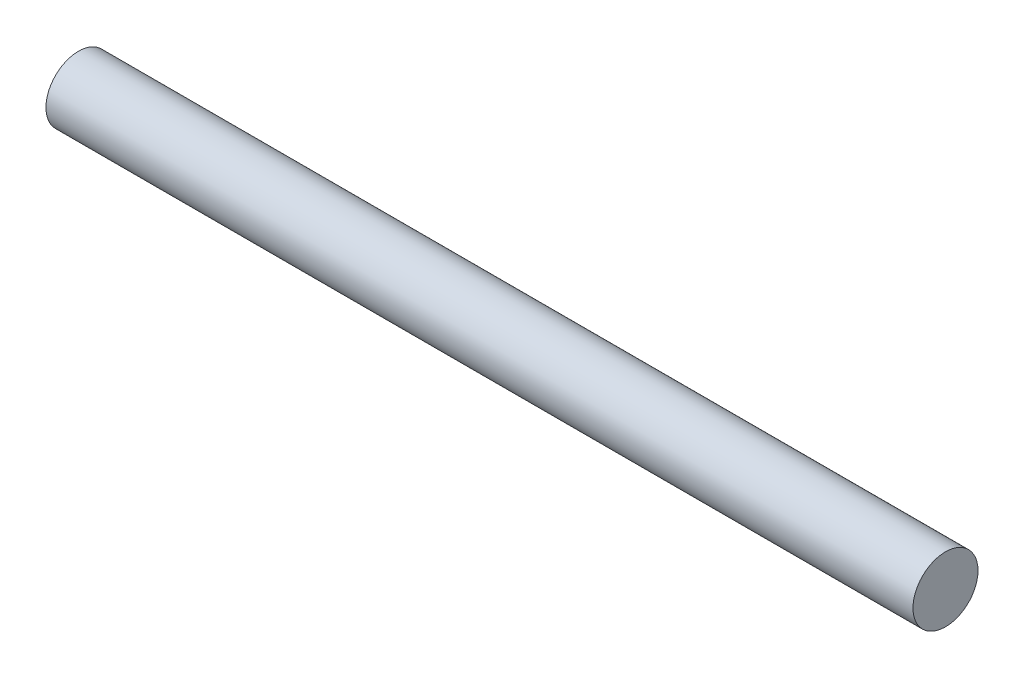
from build123d import *

# Parameters (mm, degrees)
SKETCH2_R  = 3.75
BODY_DEPTH = 100


with BuildPart() as part:
    # Sketch2 → Body (new body)
    with BuildSketch(Plane(origin=(0, 0, 0), x_dir=(0, 0, -1), z_dir=(1, 0, 0))):
        Circle(SKETCH2_R)
    extrude(amount=BODY_DEPTH)


solid = part.part
